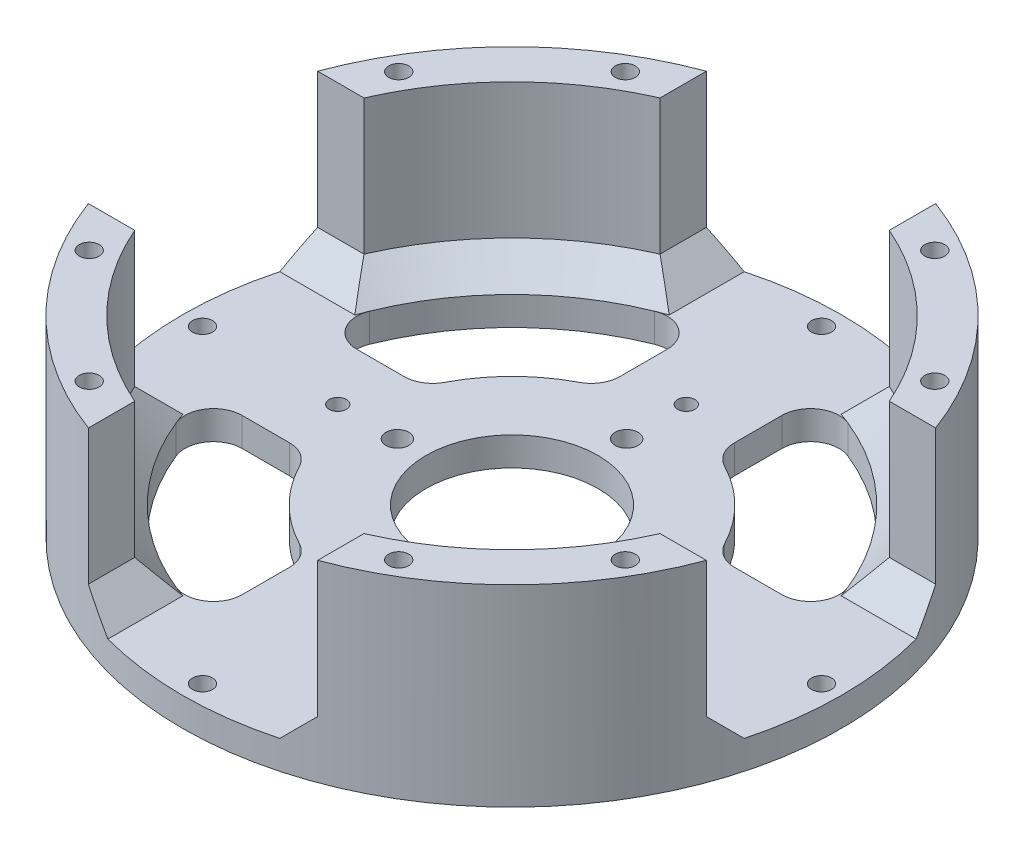
from build123d import *

# Parameters (mm, degrees)
SKETCH1_R           = 57.5
BOSS_EXTRUDE1_DEPTH = 33.6
SKETCH2_R           = 50
CUT_EXTRUDE1_DEPTH  = 28.6
SKETCH3_R           = 2
SKETCH3_R_2         = 15
CUT_EXTRUDE2_DEPTH  = 31.8
SKETCH4_R           = 1.75
SKETCH4_R_2         = 1.5
CUT_EXTRUDE3_DEPTH  = 50
SKETCH9_W           = 40
SKETCH9_H           = 28.6
CUT_EXTRUDE4_DEPTH  = 72
CIRPATTERN1_COUNT   = 4
FILLET2_R           = 5
CHAMFER1_SIZE       = 5


with BuildPart() as part:
    # Sketch1 → Boss-Extrude1 (new body)
    with BuildSketch(Plane(origin=(0, 0, 0), x_dir=(1, 0, 0), z_dir=(0, 1, 0))):
        with Locations(Location((0, 0, 0), (0, 0, 270))):
            Circle(SKETCH1_R)
    extrude(amount=BOSS_EXTRUDE1_DEPTH)

    # Sketch2 → Cut-Extrude1 (cut)
    with BuildSketch(Plane(origin=(0, 33.6, 0), x_dir=(1, 0, 0), z_dir=(0, 1, 0))):
        with Locations(Location((0, 0, 0), (0, 0, 270))):
            Circle(SKETCH2_R)
    extrude(amount=-CUT_EXTRUDE1_DEPTH, mode=Mode.SUBTRACT)

    # Sketch3 → Cut-Extrude2 (cut)
    with BuildSketch(Plane.XZ):
        with BuildLine():
            Line((-10, 25.617376915), (-10, 43.874821937))
            ThreePointArc((-10, 43.874821937), (-31.819805153, 31.819805153), (-43.874821937, 10))
            Line((-43.874821937, 10), (-25.617376915, 10))
            ThreePointArc((-25.617376915, 10), (-19.445436483, 19.445436483), (-10, 25.617376915))
        make_face()
        with BuildLine():
            Line((25.617376915, 10), (43.874821937, 10))
            ThreePointArc((43.874821937, 10), (31.819805153, 31.819805153), (10, 43.874821937))
            Line((10, 43.874821937), (10, 25.617376915))
            ThreePointArc((10, 25.617376915), (19.445436483, 19.445436483), (25.617376915, 10))
        make_face()
        with BuildLine():
            ThreePointArc((10, -43.874821937), (31.819805153, -31.819805153), (43.874821937, -10))
            Line((43.874821937, -10), (25.617376915, -10))
            ThreePointArc((25.617376915, -10), (19.445436483, -19.445436483), (10, -25.617376915))
            Line((10, -25.617376915), (10, -43.874821937))
        make_face()
        with BuildLine():
            ThreePointArc((-43.874821937, -10), (-31.819805153, -31.819805153), (-10, -43.874821937))
            Line((-10, -43.874821937), (-10, -25.617376915))
            ThreePointArc((-10, -25.617376915), (-19.445436483, -19.445436483), (-25.617376915, -10))
            Line((-25.617376915, -10), (-43.874821937, -10))
        make_face()
        with Locations(Location((-20, 0, 0), (0, 0, 270))):
            Circle(SKETCH3_R)
        with Locations(Location((0, 0, 0), (0, 0, 270))):
            Circle(SKETCH3_R_2)
        with Locations(Location((0, 20, 0), (0, 0, 270))):
            Circle(SKETCH3_R)
        with Locations(Location((20, 0, 0), (0, 0, 270))):
            Circle(SKETCH3_R)
        with Locations(Location((0, -20, 0), (0, 0, 270))):
            Circle(SKETCH3_R)
    extrude(amount=-CUT_EXTRUDE2_DEPTH, mode=Mode.SUBTRACT)

    # Sketch4 → Cut-Extrude3 (cut)
    with BuildSketch(Plane.XZ):
        with Locations(Location((0, 54, 0), (0, 0, 270))):
            Circle(SKETCH4_R)
        with Locations(Location((27, 46.765371804, 0), (0, 0, 270))):
            Circle(SKETCH4_R)
        with Locations(Location((46.765371804, 27, 0), (0, 0, 270))):
            Circle(SKETCH4_R)
        with Locations(Location((54, 0, 0), (0, 0, 270))):
            Circle(SKETCH4_R)
        with Locations(Location((46.765371804, -27, 0), (0, 0, 270))):
            Circle(SKETCH4_R)
        with Locations(Location((27, -46.765371804, 0), (0, 0, 270))):
            Circle(SKETCH4_R)
        with Locations(Location((0, -54, 0), (0, 0, 270))):
            Circle(SKETCH4_R)
        with Locations(Location((-27, -46.765371804, 0), (0, 0, 270))):
            Circle(SKETCH4_R)
        with Locations(Location((-46.765371804, -27, 0), (0, 0, 270))):
            Circle(SKETCH4_R)
        with Locations(Location((-54, 0, 0), (0, 0, 270))):
            Circle(SKETCH4_R)
        with Locations(Location((-46.765371804, 27, 0), (0, 0, 270))):
            Circle(SKETCH4_R)
        with Locations(Location((-27, 46.765371804, 0), (0, 0, 270))):
            Circle(SKETCH4_R)
        with Locations(Location((0, 30.405591591, 0), (0, 0, 270))):
            Circle(SKETCH4_R_2)
        with Locations(Location((30.405591591, 0, 0), (0, 0, 270))):
            Circle(SKETCH4_R_2)
        with Locations(Location((0, -30.405591591, 0), (0, 0, 270))):
            Circle(SKETCH4_R_2)
        with Locations(Location((-30.405591591, 0, 0), (0, 0, 270))):
            Circle(SKETCH4_R_2)
    extrude(amount=-CUT_EXTRUDE3_DEPTH, mode=Mode.SUBTRACT)

    # Sketch9 → Cut-Extrude4 (cut)
    with BuildSketch(Plane.XY):
        with Locations((0, 19.3)):
            Rectangle(SKETCH9_W, SKETCH9_H)
    cut_extrude4 = extrude(amount=-CUT_EXTRUDE4_DEPTH, mode=Mode.SUBTRACT)

    # CirPattern1: Cut-Extrude4 ×4 about axis
    cirpattern1_axis = Axis((0, 0, 0), (0, 1, 0))
    for i in range(1, CIRPATTERN1_COUNT):
        add(cut_extrude4.rotate(cirpattern1_axis, i * 360 / CIRPATTERN1_COUNT), mode=Mode.SUBTRACT)

    # Fillet2
    fillet2_edges = [part.edges().sort_by_distance(p)[0] for p in [
        (43.874821937, 2.5, 10),
        (25.617376915, 2.5, 10),
        (10, 2.5, 25.617376915),
        (10, 2.5, 43.874821937),
        (10, 2.5, -43.874821937),
        (10, 2.5, -25.617376915),
        (25.617376915, 2.5, -10),
        (43.874821937, 2.5, -10),
        (-43.874821937, 2.5, -10),
        (-25.617376915, 2.5, -10),
        (-10, 2.5, -25.617376915),
        (-10, 2.5, -43.874821937),
        (-10, 2.5, 43.874821937),
        (-10, 2.5, 25.617376915),
        (-25.617376915, 2.5, 10),
        (-43.874821937, 2.5, 10),
    ]]
    fillet(fillet2_edges, radius=FILLET2_R)

    # Chamfer1
    chamfer1_edges = [part.edges().sort_by_distance(p)[0] for p in [
        (-35.355339059, 5, -35.355339059),
        (-20, 5, -49.867701791),
        (20, 5, -49.867701791),
        (-35.355339059, 5, 35.355339059),
        (35.355339059, 5, 35.355339059),
        (35.355339059, 5, -35.355339059),
        (-49.867701791, 5, 20),
        (20, 5, 49.867701791),
        (49.867701791, 5, -20),
        (49.867701791, 5, 20),
        (-20, 5, 49.867701791),
        (-49.867701791, 5, -20),
    ]]
    chamfer(chamfer1_edges, length=CHAMFER1_SIZE - 0.0001)  # a hair under: the kernel refuses the full size


solid = part.part
